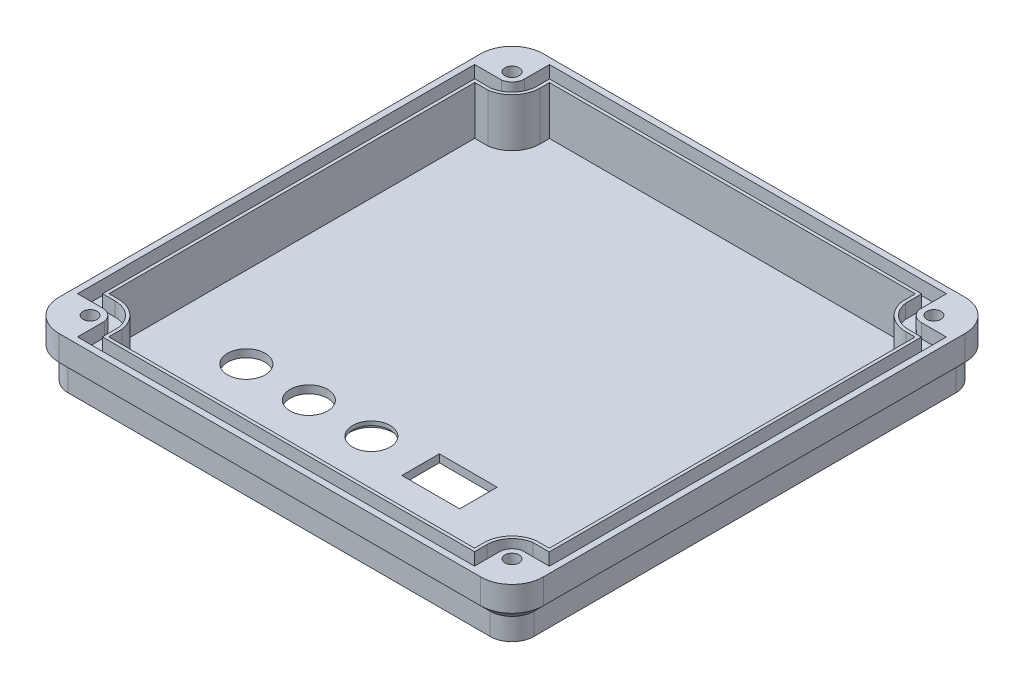
from build123d import *

# Parameters (mm, degrees)
BOSS_EXTRUDE1_DEPTH    = 18
CUT_EXTRUDE1_DEPTH     = 10
CHAMFER1_SIZE          = 3
CUT_EXTRUDE5_START     = -15.5
CUT_EXTRUDE5_DEPTH     = 15.5
CUT_EXTRUDE6_DEPTH     = 4.5
SKETCH3_6_R            = 2.25
CUT_EXTRUDE8_DEPTH     = 7
CUT_EXTRUDE9_START     = -2.5
CUT_EXTRUDE9_OUTLINE_W = 18.5
CUT_EXTRUDE9_OUTLINE_H = 12
CUT_EXTRUDE9_OUTLINE_R = 6
CUT_EXTRUDE9_DEPTH     = 2.5
CUT_EXTRUDE17_START    = -13
SKETCH8_R              = 4
CUT_EXTRUDE17_DEPTH    = 13
CHAMFER2_SIZE          = 0.8
SKETCH10_R             = 7
SKETCH10_R_2           = 6
CUT_EXTRUDE19_DEPTH    = 1.2


# Read off the part's stored shape, not the designer's step: Cut-Extrude9
with BuildPart() as part:
    # Sketch1 → Boss-Extrude1 (new body)
    with BuildSketch(Plane(origin=(0, 0, 0), x_dir=(1, 0, 0), z_dir=(0, 1, 0))):
        with BuildLine():
            Line((-67.5, -77.5), (67.5, -77.5))
            ThreePointArc((67.5, -77.5), (74.571067812, -74.571067812), (77.5, -67.5))
            Line((77.5, -67.5), (77.5, 67.5))
            ThreePointArc((77.5, 67.5), (74.571067812, 74.571067812), (67.5, 77.5))
            Line((67.5, 77.5), (-67.5, 77.5))
            ThreePointArc((-67.5, 77.5), (-74.571067812, 74.571067812), (-77.5, 67.5))
            Line((-77.5, 67.5), (-77.5, -67.5))
            ThreePointArc((-77.5, -67.5), (-74.571067812, -74.571067812), (-67.5, -77.5))
        make_face()
    extrude(amount=BOSS_EXTRUDE1_DEPTH)

    # Sketch2 → Cut-Extrude1 (cut)
    with BuildSketch(Plane(origin=(0, 0, 0), x_dir=(1, 0, 0), z_dir=(0, 1, 0))):
        with BuildLine():
            Line((77.5, -67.5), (77.5, 67.5))
            ThreePointArc((77.5, 67.5), (74.571067812, 74.571067812), (67.5, 77.5))
            Line((67.5, 77.5), (-67.5, 77.5))
            ThreePointArc((-67.5, 77.5), (-74.571067812, 74.571067812), (-77.5, 67.5))
            Line((-77.5, 67.5), (-77.5, -67.5))
            ThreePointArc((-77.5, -67.5), (-74.571067812, -74.571067812), (-67.5, -77.5))
            Line((-67.5, -77.5), (67.5, -77.5))
            ThreePointArc((67.5, -77.5), (74.571067812, -74.571067812), (77.5, -67.5))
        make_face()
        with BuildLine():
            Line((-74.5, 67.5), (-74.5, -67.5))
            ThreePointArc((-74.5, -67.5), (-72.449747468, -72.449747468), (-67.5, -74.5))
            Line((-67.5, -74.5), (67.5, -74.5))
            ThreePointArc((67.5, -74.5), (72.449747468, -72.449747468), (74.5, -67.5))
            Line((74.5, -67.5), (74.5, 67.5))
            ThreePointArc((74.5, 67.5), (72.449747468, 72.449747468), (67.5, 74.5))
            Line((67.5, 74.5), (-67.5, 74.5))
            ThreePointArc((-67.5, 74.5), (-72.449747468, 72.449747468), (-74.5, 67.5))
        make_face(mode=Mode.SUBTRACT)
    extrude(amount=CUT_EXTRUDE1_DEPTH, mode=Mode.SUBTRACT)

    # Chamfer1
    chamfer1_edges = [part.edges().sort_by_distance(p)[0] for p in [
        (-72.449747468, 10, -72.449747468),
        (-74.5, 10, 0),
        (-72.449747468, 10, 72.449747468),
        (0, 10, 74.5),
        (72.449747468, 10, 72.449747468),
        (74.5, 10, 0),
        (72.449747468, 10, -72.449747468),
        (0, 10, -74.5),
    ]]
    chamfer(chamfer1_edges, length=CHAMFER1_SIZE - 0.0001)  # a hair under: the kernel refuses the full size

    # Sketch3 → Cut-Extrude5 (cut)
    with BuildSketch(Plane(origin=(0, 18, 0), x_dir=(1, 0, 0), z_dir=(0, 1, 0)).offset(CUT_EXTRUDE5_START)):
        with BuildLine():
            Line((67.5, 58.5), (70.5, 58.5))
            Line((70.5, 58.5), (70.5, -58.584654437))
            Line((70.5, -58.584654437), (66.268491377, -58.584654437))
            ThreePointArc((66.268491377, -58.584654437), (60.714590005, -61.58745307), (58.5, -67.5))
            Line((58.5, -67.5), (58.5, -70.5))
            Line((58.5, -70.5), (-58.584654437, -70.5))
            Line((-58.584654437, -70.5), (-58.584654437, -66.268491377))
            ThreePointArc((-58.584654437, -66.268491377), (-61.58745307, -60.714590005), (-67.5, -58.5))
            Line((-67.5, -58.5), (-70.5, -58.5))
            Line((-70.5, -58.5), (-70.5, 58.584654437))
            Line((-70.5, 58.584654437), (-66.268491377, 58.584654437))
            ThreePointArc((-66.268491377, 58.584654437), (-60.714590005, 61.58745307), (-58.5, 67.5))
            Line((-58.5, 67.5), (-58.5, 70.5))
            Line((-58.5, 70.5), (58.584654437, 70.5))
            Line((58.584654437, 70.5), (58.584654437, 66.268491377))
            ThreePointArc((58.584654437, 66.268491377), (61.58745307, 60.714590005), (67.5, 58.5))
        make_face()
    extrude(amount=CUT_EXTRUDE5_DEPTH, mode=Mode.SUBTRACT)

    # Sketch3<5> → Cut-Extrude6 (cut)
    with BuildSketch(Plane(origin=(0, 18, 0), x_dir=(1, 0, 0), z_dir=(0, 1, 0))):
        with BuildLine():
            Line((75.5, -63.542327218), (75.5, 63.5))
            Line((75.5, 63.5), (67.5, 63.5))
            ThreePointArc((67.5, 63.5), (64.884801062, 64.473329467), (63.542327218, 66.919632742))
            Line((63.542327218, 66.919632742), (63.542327218, 75.5))
            Line((63.542327218, 75.5), (-63.5, 75.5))
            Line((-63.5, 75.5), (-63.5, 67.5))
            ThreePointArc((-63.5, 67.5), (-64.473329467, 64.884801062), (-66.919632742, 63.542327218))
            Line((-66.919632742, 63.542327218), (-75.5, 63.542327218))
            Line((-75.5, 63.542327218), (-75.5, -63.5))
            Line((-75.5, -63.5), (-67.5, -63.5))
            ThreePointArc((-67.5, -63.5), (-64.884801062, -64.473329467), (-63.542327218, -66.919632742))
            Line((-63.542327218, -66.919632742), (-63.542327218, -75.5))
            Line((-63.542327218, -75.5), (63.5, -75.5))
            Line((63.5, -75.5), (63.5, -67.5))
            ThreePointArc((63.5, -67.5), (64.473329467, -64.884801062), (66.919632742, -63.542327218))
            Line((66.919632742, -63.542327218), (75.5, -63.542327218))
        make_face()
        with BuildLine():
            Line((-67.5, -59.5), (-71.5, -59.5))
            Line((-71.5, -59.5), (-71.5, 59.584654437))
            Line((-71.5, 59.584654437), (-66.339265485, 59.584654437))
            ThreePointArc((-66.339265485, 59.584654437), (-61.446658934, 62.269602124), (-59.5, 67.5))
            Line((-59.5, 67.5), (-59.5, 71.5))
            Line((-59.5, 71.5), (59.584654437, 71.5))
            Line((59.584654437, 71.5), (59.584654437, 66.339265485))
            ThreePointArc((59.584654437, 66.339265485), (62.269602124, 61.446658934), (67.5, 59.5))
            Line((67.5, 59.5), (71.5, 59.5))
            Line((71.5, 59.5), (71.5, -59.584654437))
            Line((71.5, -59.584654437), (66.339265485, -59.584654437))
            ThreePointArc((66.339265485, -59.584654437), (61.446658934, -62.269602124), (59.5, -67.5))
            Line((59.5, -67.5), (59.5, -71.5))
            Line((59.5, -71.5), (-59.584654437, -71.5))
            Line((-59.584654437, -71.5), (-59.584654437, -66.339265485))
            ThreePointArc((-59.584654437, -66.339265485), (-62.269602124, -61.446658934), (-67.5, -59.5))
        make_face(mode=Mode.SUBTRACT)
    extrude(amount=-CUT_EXTRUDE6_DEPTH, mode=Mode.SUBTRACT)

    # Sketch3<6> → Cut-Extrude8 (cut)
    with BuildSketch(Plane(origin=(0, 18, 0), x_dir=(1, 0, 0), z_dir=(0, 1, 0))):
        with Locations(Location((-67.5, -67.5, 0), (0, 0, 270))):
            Circle(SKETCH3_6_R)
        with Locations(Location((-67.5, 67.5, 0), (0, 0, 270))):
            Circle(SKETCH3_6_R)
        with Locations(Location((67.5, 67.5, 0), (0, 0, 270))):
            Circle(SKETCH3_6_R)
        with Locations(Location((67.5, -67.5, 0), (0, 0, 270))):
            Circle(SKETCH3_6_R)
    extrude(amount=-CUT_EXTRUDE8_DEPTH, mode=Mode.SUBTRACT)

    # Cut-Extrude9 outline → Cut-Extrude9 (cut)
    with BuildSketch(Plane(origin=(0, 2.5, 0), x_dir=(1, 0, 0), z_dir=(0, 1, 0)).offset(CUT_EXTRUDE9_START)):
        with Locations((20.5, -40.5)):
            Rectangle(CUT_EXTRUDE9_OUTLINE_W, CUT_EXTRUDE9_OUTLINE_H)
        with Locations((-24.5, -40.5)):
            Circle(CUT_EXTRUDE9_OUTLINE_R)
        with Locations((-4.5, -40.5)):
            Circle(CUT_EXTRUDE9_OUTLINE_R)
        with Locations((-44.5, -40.5)):
            Circle(CUT_EXTRUDE9_OUTLINE_R)
    extrude(amount=CUT_EXTRUDE9_DEPTH, mode=Mode.SUBTRACT)

    # Sketch8 → Cut-Extrude17 (cut)
    with BuildSketch(Plane.XZ.offset(CUT_EXTRUDE17_START)):
        with Locations(Location((67.5, 67.5, 0), (0, 0, 270))):
            Circle(SKETCH8_R)
        with Locations(Location((67.5, -67.5, 0), (0, 0, 270))):
            Circle(SKETCH8_R)
        with Locations(Location((-67.5, -67.5, 0), (0, 0, 270))):
            Circle(SKETCH8_R)
        with Locations(Location((-67.5, 67.5, 0), (0, 0, 270))):
            Circle(SKETCH8_R)
    extrude(amount=CUT_EXTRUDE17_DEPTH, mode=Mode.SUBTRACT)

    # Chamfer2
    chamfer2_edges = [part.edges().sort_by_distance(p)[0] for p in [
        (-67.5, 13, 71.5),
        (-67.5, 13, 65.25),
        (-67.5, 13, -63.5),
        (-67.5, 13, -69.75),
        (67.5, 13, -63.5),
        (67.5, 13, -69.75),
        (67.5, 13, 71.5),
        (67.5, 13, 65.25),
    ]]
    chamfer(chamfer2_edges, length=CHAMFER2_SIZE)

    # Sketch10 → Cut-Extrude19 (cut)
    with BuildSketch(Plane.XZ):
        with Locations(Location((-4.5, 40.5, 0), (0, 0, 270))):
            Circle(SKETCH10_R)
        with Locations(Location((-4.5, 40.5, 0), (0, 0, 90))):
            Circle(SKETCH10_R_2, mode=Mode.SUBTRACT)
    extrude(amount=-CUT_EXTRUDE19_DEPTH, mode=Mode.SUBTRACT)


solid = part.part
